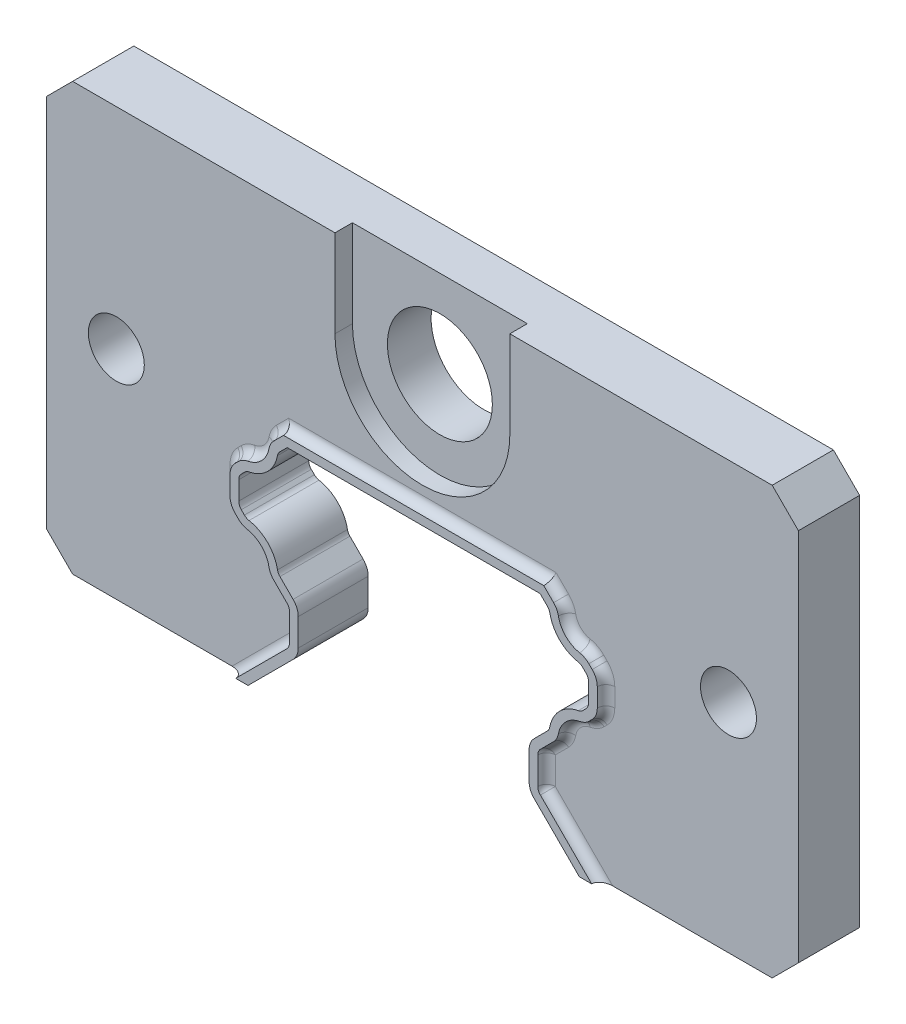
from build123d import *

# Parameters (mm, degrees)
ENDSEAL_1_DEPTH              = 3.5
BOSS_EXTRUDE1_DEPTH          = 0.5
FILLET1_R                    = 0.5
F_6_0_6_DIAMETER_HOLE1_D     = 6
F_6_0_6_DIAMETER_HOLE1_DEPTH = 12.5
F_6_0_6_DIAMETER_HOLE1_TIP   = 1.561701152
CUT_EXTRUDE2_DEPTH           = 1
F_3_2_3_2_DIAMETER_HOLE1_D   = 3.2


with BuildPart() as part:
    # Sketch4 → Endseal 1 (new body)
    with BuildSketch(Plane.XY):
        with BuildLine():
            Line((-7.230720611, 12.9), (7.230720611, 12.9))
            Line((7.230720611, 12.9), (7.647672674, 12.483047938))
            ThreePointArc((7.647672674, 12.483047938), (7.736182466, 12.363118479), (7.785406885, 12.222427275))
            ThreePointArc((7.785406885, 12.222427275), (8.344607784, 11.164307384), (9.402727675, 10.605106485))
            ThreePointArc((9.402727675, 10.605106485), (9.54341888, 10.555882066), (9.663348338, 10.467372274))
            Line((9.663348338, 10.467372274), (9.853553391, 10.277167221))
            ThreePointArc((9.853553391, 10.277167221), (9.961939766, 10.114955546), (10, 9.92361383))
            Line((10, 9.92361383), (10, 8.86638617))
            ThreePointArc((10, 8.86638617), (9.961939766, 8.675044454), (9.853553391, 8.512832779))
            Line((9.853553391, 8.512832779), (9.675343394, 8.334622782))
            ThreePointArc((9.675343394, 8.334622782), (9.554347216, 8.245550888), (9.412352167, 8.19644607))
            ThreePointArc((9.412352167, 8.19644607), (8.344607784, 7.635448616), (7.783610331, 6.567704234))
            ThreePointArc((7.783610331, 6.567704234), (7.734505512, 6.425709184), (7.645433618, 6.304713007))
            Line((7.645433618, 6.304713007), (6.892893219, 5.552172608))
            ThreePointArc((6.892893219, 5.552172608), (6.676120468, 5.227749259), (6.6, 4.845065826))
            Line((6.6, 4.845065826), (6.6, 3.284934173))
            ThreePointArc((6.6, 3.284934173), (6.676120468, 2.902250741), (6.892893219, 2.577827392))
            Line((6.892893219, 2.577827392), (9.470720611, 0))
            Line((9.470720611, 0), (19.9998779, 0))
            Line((19.9998779, 0), (21.5, 1.5))
            Line((21.5, 1.5), (21.5, 22.9))
            Line((21.5, 22.9), (20.0001221, 24.4))
            Line((20.0001221, 24.4), (-19.9998779, 24.4))
            Line((-19.9998779, 24.4), (-21.5, 22.8997558))
            Line((-21.5, 22.8997558), (-21.5, 1.5))
            Line((-21.5, 1.5), (-19.9998779, 0))
            Line((-19.9998779, 0), (-9.470720611, 0))
            Line((-9.470720611, 0), (-6.892893219, 2.577827392))
            ThreePointArc((-6.892893219, 2.577827392), (-6.676120468, 2.902250741), (-6.6, 3.284934173))
            Line((-6.6, 3.284934173), (-6.6, 4.845065826))
            ThreePointArc((-6.6, 4.845065826), (-6.676120468, 5.227749259), (-6.892893219, 5.552172608))
            Line((-6.892893219, 5.552172608), (-7.645433618, 6.304713006))
            ThreePointArc((-7.645433618, 6.304713006), (-7.734505512, 6.425709184), (-7.783610331, 6.567704233))
            ThreePointArc((-7.783610331, 6.567704233), (-8.344607784, 7.635448616), (-9.412352167, 8.19644607))
            ThreePointArc((-9.412352167, 8.19644607), (-9.554347216, 8.245550888), (-9.675343394, 8.334622782))
            Line((-9.675343394, 8.334622782), (-9.853553391, 8.512832779))
            ThreePointArc((-9.853553391, 8.512832779), (-9.961939766, 8.675044454), (-10, 8.86638617))
            Line((-10, 8.86638617), (-10, 9.92361383))
            ThreePointArc((-10, 9.92361383), (-9.961939766, 10.114955546), (-9.853553391, 10.277167221))
            Line((-9.853553391, 10.277167221), (-9.663348338, 10.467372274))
            ThreePointArc((-9.663348338, 10.467372274), (-9.543418879, 10.555882066), (-9.402727675, 10.605106485))
            ThreePointArc((-9.402727675, 10.605106485), (-8.344607784, 11.164307384), (-7.785406885, 12.222427275))
            ThreePointArc((-7.785406885, 12.222427275), (-7.736182466, 12.363118479), (-7.647672674, 12.483047938))
            Line((-7.647672674, 12.483047938), (-7.230720611, 12.9))
        make_face()
    extrude(amount=ENDSEAL_1_DEPTH)

    # Sketch6 → Boss-Extrude1 (add)
    with BuildSketch(Plane.XY.offset(3.5)):
        with BuildLine():
            Line((-10.177827392, 0), (-7.24644661, 2.931380783))
            ThreePointArc((-7.24644661, 2.931380783), (-7.138060234, 3.093592457), (-7.1, 3.284934173))
            Line((-7.1, 3.284934173), (-7.1, 4.845065826))
            ThreePointArc((-7.1, 4.845065826), (-7.138060234, 5.036407542), (-7.24644661, 5.198619217))
            Line((-7.24644661, 5.198619217), (-7.998987008, 5.951159616))
            ThreePointArc((-7.998987008, 5.951159616), (-8.177130797, 6.193151971), (-8.275340434, 6.47714207))
            ThreePointArc((-8.275340434, 6.47714207), (-8.698161175, 7.281895225), (-9.50291433, 7.704715966))
            ThreePointArc((-9.50291433, 7.704715966), (-9.786904429, 7.802925603), (-10.028896784, 7.981069392))
            Line((-10.028896784, 7.981069392), (-10.207106781, 8.159279389))
            ThreePointArc((-10.207106781, 8.159279389), (-10.423879533, 8.483702737), (-10.5, 8.86638617))
            Line((-10.5, 8.86638617), (-10.5, 9.92361383))
            ThreePointArc((-10.5, 9.92361383), (-10.423879533, 10.306297262), (-10.207106781, 10.630720611))
            Line((-10.207106781, 10.630720611), (-10.016901728, 10.820925664))
            ThreePointArc((-10.016901728, 10.820925664), (-9.777042812, 10.99794525), (-9.495660403, 11.096394087))
            ThreePointArc((-9.495660403, 11.096394087), (-8.698161175, 11.517860775), (-8.276694487, 12.315360003))
            ThreePointArc((-8.276694487, 12.315360003), (-8.17824565, 12.596742412), (-8.001226064, 12.836601328))
            Line((-8.001226064, 12.836601328), (-7.437827392, 13.4))
            Line((-7.437827392, 13.4), (7.437827392, 13.4))
            Line((7.437827392, 13.4), (8.001226064, 12.836601328))
            ThreePointArc((8.001226064, 12.836601328), (8.17824565, 12.596742412), (8.276694487, 12.315360003))
            ThreePointArc((8.276694487, 12.315360003), (8.698161175, 11.517860775), (9.495660403, 11.096394087))
            ThreePointArc((9.495660403, 11.096394087), (9.777042812, 10.99794525), (10.016901728, 10.820925664))
            Line((10.016901728, 10.820925664), (10.207106781, 10.630720611))
            ThreePointArc((10.207106781, 10.630720611), (10.423879533, 10.306297262), (10.5, 9.92361383))
            Line((10.5, 9.92361383), (10.5, 8.86638617))
            ThreePointArc((10.5, 8.86638617), (10.423879533, 8.483702738), (10.207106781, 8.159279389))
            Line((10.207106781, 8.159279389), (10.028896784, 7.981069392))
            ThreePointArc((10.028896784, 7.981069392), (9.786904429, 7.802925604), (9.50291433, 7.704715966))
            ThreePointArc((9.50291433, 7.704715966), (8.698161175, 7.281895225), (8.275340434, 6.47714207))
            ThreePointArc((8.275340434, 6.47714207), (8.177130797, 6.193151971), (7.998987008, 5.951159616))
            Line((7.998987008, 5.951159616), (7.24644661, 5.198619217))
            ThreePointArc((7.24644661, 5.198619217), (7.138060234, 5.036407543), (7.1, 4.845065826))
            Line((7.1, 4.845065826), (7.1, 3.284934173))
            ThreePointArc((7.1, 3.284934173), (7.138060234, 3.093592457), (7.24644661, 2.931380783))
            Line((7.24644661, 2.931380783), (10.177827392, 0))
            Line((10.177827392, 0), (9.470720611, 0))
            Line((9.470720611, 0), (6.892893219, 2.577827392))
            ThreePointArc((6.892893219, 2.577827392), (6.676120468, 2.902250741), (6.6, 3.284934173))
            Line((6.6, 3.284934173), (6.6, 4.845065826))
            ThreePointArc((6.6, 4.845065826), (6.676120468, 5.227749259), (6.892893219, 5.552172608))
            Line((6.892893219, 5.552172608), (7.645433618, 6.304713007))
            ThreePointArc((7.645433618, 6.304713007), (7.734505512, 6.425709184), (7.783610331, 6.567704234))
            ThreePointArc((7.783610331, 6.567704234), (8.344607784, 7.635448616), (9.412352167, 8.19644607))
            ThreePointArc((9.412352167, 8.19644607), (9.554347216, 8.245550888), (9.675343394, 8.334622782))
            Line((9.675343394, 8.334622782), (9.853553391, 8.512832779))
            ThreePointArc((9.853553391, 8.512832779), (9.961939766, 8.675044454), (10, 8.86638617))
            Line((10, 8.86638617), (10, 9.92361383))
            ThreePointArc((10, 9.92361383), (9.961939766, 10.114955546), (9.853553391, 10.277167221))
            Line((9.853553391, 10.277167221), (9.663348338, 10.467372274))
            ThreePointArc((9.663348338, 10.467372274), (9.54341888, 10.555882066), (9.402727675, 10.605106485))
            ThreePointArc((9.402727675, 10.605106485), (8.344607784, 11.164307384), (7.785406885, 12.222427275))
            ThreePointArc((7.785406885, 12.222427275), (7.736182466, 12.363118479), (7.647672674, 12.483047938))
            Line((7.647672674, 12.483047938), (7.230720611, 12.9))
            Line((7.230720611, 12.9), (-7.230720611, 12.9))
            Line((-7.230720611, 12.9), (-7.647672674, 12.483047938))
            ThreePointArc((-7.647672674, 12.483047938), (-7.736182466, 12.363118479), (-7.785406885, 12.222427275))
            ThreePointArc((-7.785406885, 12.222427275), (-8.344607784, 11.164307384), (-9.402727675, 10.605106485))
            ThreePointArc((-9.402727675, 10.605106485), (-9.543418879, 10.555882066), (-9.663348338, 10.467372274))
            Line((-9.663348338, 10.467372274), (-9.853553391, 10.277167221))
            ThreePointArc((-9.853553391, 10.277167221), (-9.961939766, 10.114955546), (-10, 9.92361383))
            Line((-10, 9.92361383), (-10, 8.86638617))
            ThreePointArc((-10, 8.86638617), (-9.961939766, 8.675044454), (-9.853553391, 8.512832779))
            Line((-9.853553391, 8.512832779), (-9.675343394, 8.334622782))
            ThreePointArc((-9.675343394, 8.334622782), (-9.554347216, 8.245550888), (-9.412352167, 8.19644607))
            ThreePointArc((-9.412352167, 8.19644607), (-8.344607784, 7.635448616), (-7.783610331, 6.567704233))
            ThreePointArc((-7.783610331, 6.567704233), (-7.734505512, 6.425709184), (-7.645433618, 6.304713006))
            Line((-7.645433618, 6.304713006), (-6.892893219, 5.552172608))
            ThreePointArc((-6.892893219, 5.552172608), (-6.676120468, 5.227749259), (-6.6, 4.845065826))
            Line((-6.6, 4.845065826), (-6.6, 3.284934173))
            ThreePointArc((-6.6, 3.284934173), (-6.676120468, 2.902250741), (-6.892893219, 2.577827392))
            Line((-6.892893219, 2.577827392), (-9.470720611, 0))
            Line((-9.470720611, 0), (-10.177827392, 0))
        make_face()
    extrude(amount=BOSS_EXTRUDE1_DEPTH)

    # Fillet1
    fillet1_edges = [part.edges().sort_by_distance(p)[0] for p in [
        (-7.719526728, 13.118300664, 3.5),
        (-8.17824565, 12.596742412, 3.5),
        (-8.698161175, 11.517860775, 3.5),
        (-9.777042812, 10.99794525, 3.5),
        (-10.112004255, 10.725823138, 3.5),
        (-10.423879533, 10.306297262, 3.5),
        (-10.5, 9.395, 3.5),
        (-10.423879533, 8.483702737, 3.5),
        (-10.118001783, 8.07017439, 3.5),
        (-9.786904429, 7.802925603, 3.5),
        (-8.698161175, 7.281895225, 3.5),
        (-8.177130797, 6.193151971, 3.5),
        (-7.622716809, 5.574889416, 3.5),
        (-7.138060234, 5.036407542, 3.5),
        (-7.1, 4.065, 3.5),
        (-7.138060234, 3.093592457, 3.5),
        (7.719526728, 13.118300664, 3.5),
        (8.17824565, 12.596742412, 3.5),
        (8.698161175, 11.517860775, 3.5),
        (9.777042812, 10.99794525, 3.5),
        (10.112004255, 10.725823138, 3.5),
        (10.423879533, 10.306297262, 3.5),
        (10.5, 9.395, 3.5),
        (10.423879533, 8.483702738, 3.5),
        (10.118001783, 8.07017439, 3.5),
        (9.786904429, 7.802925604, 3.5),
        (8.698161175, 7.281895225, 3.5),
        (8.177130797, 6.193151971, 3.5),
        (7.622716809, 5.574889417, 3.5),
        (7.138060234, 5.036407543, 3.5),
        (7.1, 4.065, 3.5),
        (7.138060234, 3.093592457, 3.5),
        (-8.712137001, 1.465690391, 3.5),
        (0, 13.4, 3.5),
        (8.712137001, 1.465690391, 3.5),
    ]]
    fillet(fillet1_edges, radius=FILLET1_R - 0.0001)  # a hair under: the kernel refuses the full size

    # Ø6.0 (6) Diameter Hole1
    with Locations(Plane.XY.offset(3.5)):
        with Locations((0, 19.4)):
            Hole(F_6_0_6_DIAMETER_HOLE1_D / 2, depth=F_6_0_6_DIAMETER_HOLE1_DEPTH)
            with Locations((0, 0, -(F_6_0_6_DIAMETER_HOLE1_DEPTH + F_6_0_6_DIAMETER_HOLE1_TIP / 2))):  # 125° drill point
                Cone(0, F_6_0_6_DIAMETER_HOLE1_D / 2, F_6_0_6_DIAMETER_HOLE1_TIP, mode=Mode.SUBTRACT)

    # Sketch9 → Cut-Extrude2 (cut)
    with BuildSketch(Plane.XY.offset(3.5)):
        with BuildLine():
            Line((5, 19.4), (5, 35))
            Line((5, 35), (-5, 35))
            Line((-5, 35), (-5, 19.4))
            ThreePointArc((-5, 19.4), (0, 14.4), (5, 19.4))
        make_face()
    extrude(amount=-CUT_EXTRUDE2_DEPTH, mode=Mode.SUBTRACT)

    # Ø3.2 (3.2) Diameter Hole1 (through all)
    with Locations(Plane.XY.offset(3.5)):
        with Locations((-17.5, 12.4), (17.5, 12.4)):
            Hole(F_3_2_3_2_DIAMETER_HOLE1_D / 2)


solid = part.part
